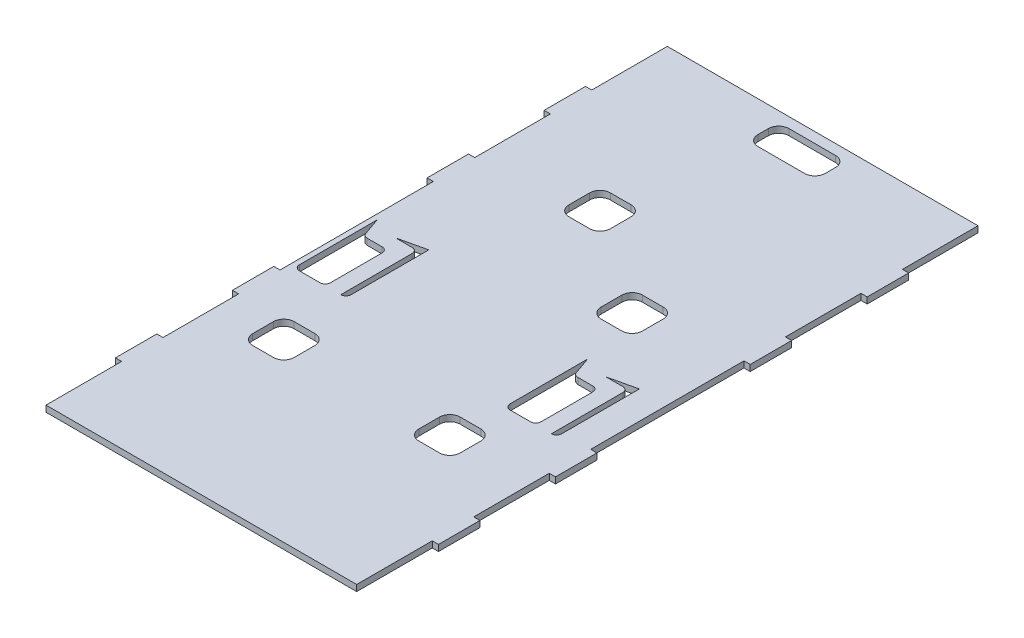
from build123d import *

# Parameters (mm, degrees)
BOSS_EXTRUDE1_DEPTH = 6
SKETCH2_W           = 40
SKETCH2_H           = 40
CUT_EXTRUDE1_DEPTH  = 10
FILLET1_R           = 10
CUT_EXTRUDE4_DEPTH  = 16
FILLET2_R           = 5
FILLET3_R           = 5
CUT_EXTRUDE5_DEPTH  = 16
FILLET4_R           = 5
SKETCH5_W           = 40
SKETCH5_H           = 40
CUT_EXTRUDE6_DEPTH  = 16
FILLET5_R           = 10
SKETCH6_W           = 65
SKETCH6_H           = 30
CUT_EXTRUDE7_DEPTH  = 16
FILLET6_R           = 10


with BuildPart() as part:
    # Sketch1 → Boss-Extrude1 (new body)
    with BuildSketch(Plane(origin=(0, 0, 0), x_dir=(1, 0, 0), z_dir=(0, 1, 0))):
        Polygon((-157.408498061, 145.557138299), (-157.408498061, 72.557138299), (-163.408498061, 72.557138299), (-163.408498061, 32.557138299), (-157.408498061, 32.557138299), (-157.408498061, -115.442861701), (-163.408498061, -115.442861701), (-163.408498061, -155.442861701), (-157.408498061, -155.442861701), (-157.408498061, -228.442861701), (-163.408498061, -228.442861701), (-163.408498061, -268.442861701), (-157.408498061, -268.442861701), (-157.408498061, -341.442861701), (142.591501939, -341.442861701), (142.591501939, -268.442861701), (148.591501939, -268.442861701), (148.591501939, -228.442861701), (142.591501939, -228.442861701), (142.591501939, -155.442861701), (148.591501939, -155.442861701), (148.591501939, -115.442861701), (142.591501939, -115.442861701), (142.591501939, 32.557138299), (148.591501939, 32.557138299), (148.591501939, 72.557138299), (142.591501939, 72.557138299), (142.591501939, 145.557138299), (148.591501939, 145.557138299), (148.591501939, 185.557138299), (142.591501939, 185.557138299), (142.591501939, 258.557138299), (-157.408498061, 258.557138299), (-157.408498061, 185.557138299), (-163.408498061, 185.557138299), (-163.408498061, 145.557138299), align=None)
    extrude(amount=BOSS_EXTRUDE1_DEPTH)

    # Sketch2 → Cut-Extrude1 (cut)
    with BuildSketch(Plane(origin=(0, 6, 0), x_dir=(1, 0, 0), z_dir=(0, 1, 0))):
        with Locations((-97.408498061, -171.800004558)):
            Rectangle(SKETCH2_W, SKETCH2_H)
        with Locations((62.591501939, -171.442861701)):
            Rectangle(SKETCH2_W, SKETCH2_H)
    extrude(amount=-CUT_EXTRUDE1_DEPTH, mode=Mode.SUBTRACT)

    # Fillet1
    fillet1_edges = [part.edges().sort_by_distance(p)[0] for p in [
        (-117.408498061, 3, 191.800004558),
        (-117.408498061, 3, 151.800004558),
        (-77.408498061, 3, 151.800004558),
        (-77.408498061, 3, 191.800004558),
        (42.591501939, 3, 191.442861701),
        (42.591501939, 3, 151.442861701),
        (82.591501939, 3, 151.442861701),
        (82.591501939, 3, 191.442861701),
    ]]
    fillet(fillet1_edges, radius=FILLET1_R)

    # Sketch3 → Cut-Extrude4 (cut)
    with BuildSketch(Plane(origin=(0, 6, 0), x_dir=(1, 0, 0), z_dir=(0, 1, 0))):
        Polygon((-102.408498061, -26.800004558), (-102.408498061, -106.800004558), (-107.408498061, -106.800004558), (-107.408498061, -32.800004558), (-128.408498061, -32.800004558), align=None)
        Polygon((-152.408498061, -106.800004558), (-122.408498061, -106.800004558), (-122.408498061, -46.800004558), (-145.408498061, -46.800004558), (-152.408498061, -26.800004558), align=None)
    extrude(amount=-CUT_EXTRUDE4_DEPTH, mode=Mode.SUBTRACT)

    # Fillet2
    fillet2_edges = [part.edges().sort_by_distance(p)[0] for p in [
        (-107.408498061, 3, 32.800004558),
        (-145.408498061, 3, 46.800004558),
        (-122.408498061, 3, 46.800004558),
    ]]
    fillet(fillet2_edges, radius=FILLET2_R)

    # Fillet3
    fillet3_edges = [part.edges().sort_by_distance(p)[0] for p in [
        (-102.408498061, 3, 106.800004558),
        (-152.408498061, 3, 106.800004558),
        (-122.408498061, 3, 106.800004558),
    ]]
    fillet(fillet3_edges, radius=FILLET3_R - 0.0001)  # a hair under: the kernel refuses the full size

    # Sketch4 → Cut-Extrude5 (cut)
    with BuildSketch(Plane(origin=(0, 6, 0), x_dir=(1, 0, 0), z_dir=(0, 1, 0))):
        Polygon((65.591501939, -41.442861701), (65.591501939, -121.442861701), (95.591501939, -121.442861701), (95.591501939, -61.442861701), (72.591501939, -61.442861701), align=None)
        Polygon((115.591501939, -41.442861701), (89.591501939, -47.442861701), (110.591501939, -47.442861701), (110.591501939, -121.442861701), (115.591501939, -121.442861701), align=None)
    extrude(amount=-CUT_EXTRUDE5_DEPTH, mode=Mode.SUBTRACT)

    # Fillet4
    fillet4_edges = [part.edges().sort_by_distance(p)[0] for p in [
        (115.591501939, 3, 121.442861701),
        (110.591501939, 3, 47.442861701),
        (72.591501939, 3, 61.442861701),
        (95.591501939, 3, 61.442861701),
        (95.591501939, 3, 121.442861701),
        (65.591501939, 3, 121.442861701),
    ]]
    fillet(fillet4_edges, radius=FILLET4_R - 0.0001)  # a hair under: the kernel refuses the full size

    # Sketch5 → Cut-Extrude6 (cut)
    with BuildSketch(Plane(origin=(0, 6, 0), x_dir=(1, 0, 0), z_dir=(0, 1, 0))):
        with Locations((-52.408498061, 88.557138299)):
            Rectangle(SKETCH5_W, SKETCH5_H)
        with Locations((48.591501939, 18.557138299)):
            Rectangle(SKETCH5_W, SKETCH5_H)
    extrude(amount=-CUT_EXTRUDE6_DEPTH, mode=Mode.SUBTRACT)

    # Fillet5
    fillet5_edges = [part.edges().sort_by_distance(p)[0] for p in [
        (-32.408498061, 3, -108.557138299),
        (-32.408498061, 3, -68.557138299),
        (-72.408498061, 3, -68.557138299),
        (-72.408498061, 3, -108.557138299),
        (28.591501939, 3, 1.442861701),
        (28.591501939, 3, -38.557138299),
        (68.591501939, 3, -38.557138299),
        (68.591501939, 3, 1.442861701),
    ]]
    fillet(fillet5_edges, radius=FILLET5_R)

    # Sketch6 → Cut-Extrude7 (cut)
    with BuildSketch(Plane(origin=(0, 6, 0), x_dir=(1, 0, 0), z_dir=(0, 1, 0))):
        with Locations((-7.408498061, 233.557138299)):
            Rectangle(SKETCH6_W, SKETCH6_H)
    extrude(amount=-CUT_EXTRUDE7_DEPTH, mode=Mode.SUBTRACT)

    # Fillet6
    fillet6_edges = [part.edges().sort_by_distance(p)[0] for p in [
        (25.091501939, 3, -248.557138299),
        (25.091501939, 3, -218.557138299),
        (-39.908498061, 3, -218.557138299),
        (-39.908498061, 3, -248.557138299),
    ]]
    fillet(fillet6_edges, radius=FILLET6_R)


solid = part.part
